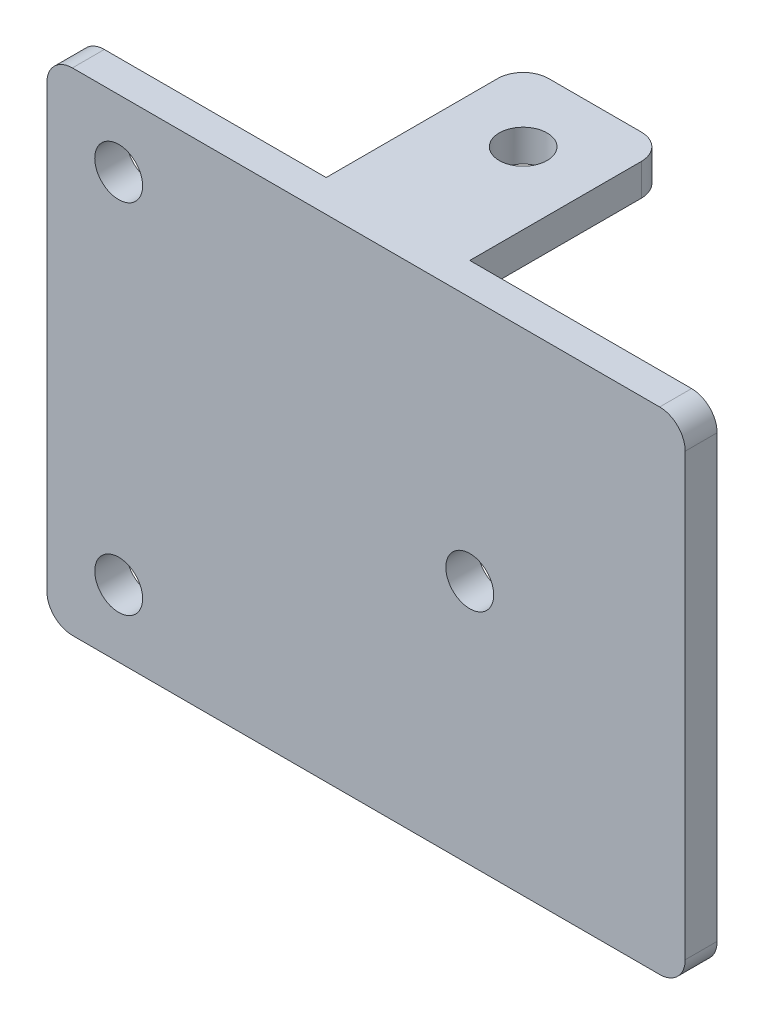
from build123d import *

# Parameters (mm, degrees)
SKETCH1_W           = 63.5
SKETCH1_H           = 48.895
BOSS_EXTRUDE1_DEPTH = 3.175
CUT_EXTRUDE1_REACH  = 82.206
SKETCH4_R           = 2.38125
SKETCH6_W           = 14.2875
SKETCH6_H           = 19.598132
BOSS_EXTRUDE3_DEPTH = 3.175
CUT_EXTRUDE2_REACH  = 84.505
SKETCH7_R           = 2.38125
FILLET1_R           = 2.54


with BuildPart() as part:
    # Sketch1 → Boss-Extrude1 (new body)
    with BuildSketch(Plane.XY):
        with Locations((31.75, 24.4475)):
            Rectangle(SKETCH1_W, SKETCH1_H)
    extrude(amount=BOSS_EXTRUDE1_DEPTH)

    # Sketch4 → Cut-Extrude1 (cut, up to next)
    with BuildSketch(Plane.XY.offset(3.175), mode=Mode.PRIVATE) as cut_extrude1_sk1:
        with Locations((7.14375, 6.6675)):
            Circle(SKETCH4_R)
    cut_extrude1_tool1 = extrude(cut_extrude1_sk1.sketch, amount=-CUT_EXTRUDE1_REACH, mode=Mode.PRIVATE) & part.part
    # Sketch4 → Cut-Extrude1 (cut, up to next)
    with BuildSketch(Plane.XY.offset(3.175), mode=Mode.PRIVATE) as cut_extrude1_sk2:
        with Locations((7.14375, 42.2275)):
            Circle(SKETCH4_R)
    cut_extrude1_tool2 = extrude(cut_extrude1_sk2.sketch, amount=-CUT_EXTRUDE1_REACH, mode=Mode.PRIVATE) & part.part
    # Sketch4 → Cut-Extrude1 (cut, up to next)
    with BuildSketch(Plane.XY.offset(3.175), mode=Mode.PRIVATE) as cut_extrude1_sk3:
        with Locations((42.06875, 24.4475)):
            Circle(SKETCH4_R)
    cut_extrude1_tool3 = extrude(cut_extrude1_sk3.sketch, amount=-CUT_EXTRUDE1_REACH, mode=Mode.PRIVATE) & part.part
    add(cut_extrude1_tool1.solids().sort_by_distance((7.14375, 6.6675, 3.175))[0], mode=Mode.SUBTRACT)
    add(cut_extrude1_tool2.solids().sort_by_distance((7.14375, 42.2275, 3.175))[0], mode=Mode.SUBTRACT)
    add(cut_extrude1_tool3.solids().sort_by_distance((42.06875, 24.4475, 3.175))[0], mode=Mode.SUBTRACT)

    # Sketch6 → Boss-Extrude3 (add)
    with BuildSketch(Plane(origin=(0, 48.895, 0), x_dir=(1, 0, 0), z_dir=(0, 1, 0))):
        with Locations((31.75, 9.799066)):
            Rectangle(SKETCH6_W, SKETCH6_H)
    extrude(amount=-BOSS_EXTRUDE3_DEPTH)

    # Sketch7 → Cut-Extrude2 (cut, up to next)
    with BuildSketch(Plane(origin=(0, 48.895, 0), x_dir=(1, 0, 0), z_dir=(0, 1, 0)), mode=Mode.PRIVATE) as cut_extrude2_sk1:
        with Locations((31.75, 12.454382)):
            Circle(SKETCH7_R)
    cut_extrude2_tool1 = extrude(cut_extrude2_sk1.sketch, amount=-CUT_EXTRUDE2_REACH, mode=Mode.PRIVATE) & part.part
    add(cut_extrude2_tool1.solids().sort_by_distance((31.75, 48.895, -12.454382))[0], mode=Mode.SUBTRACT)

    # Fillet1
    fillet1_edges = [part.edges().sort_by_distance(p)[0] for p in [
        (0, 0, 1.5875),
        (63.5, 0, 1.5875),
        (0, 48.895, 1.5875),
        (63.5, 48.895, 1.5875),
        (24.60625, 47.3075, -19.598132),
        (38.89375, 47.3075, -19.598132),
    ]]
    fillet(fillet1_edges, radius=FILLET1_R)


solid = part.part
